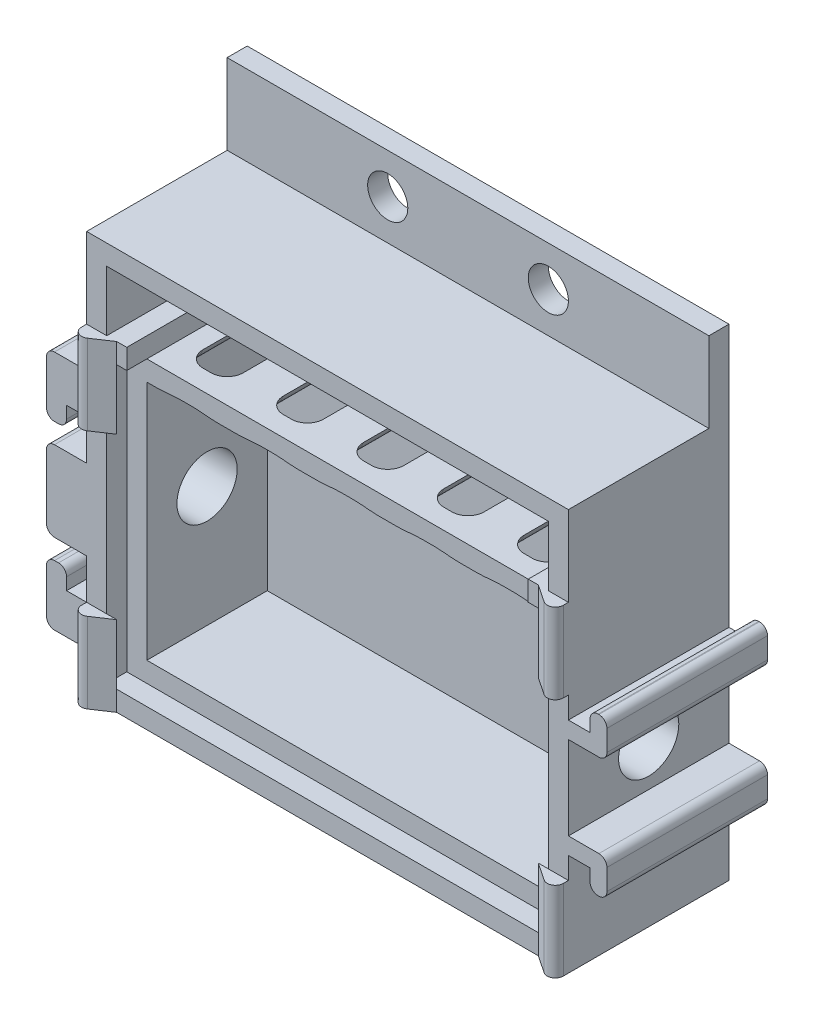
from build123d import *

# Parameters (mm, degrees)
SKETCH1_W               = 76.2
SKETCH1_H               = 76.2
BOSS_EXTRUDE1_DEPTH     = 25.4
SKETCH2_W               = 69.85
SKETCH2_H               = 44.45
CUT_EXTRUDE1_DEPTH      = 3.175
SKETCH9_W               = 63.5
SKETCH9_H               = 38.1
CUT_EXTRUDE9_DEPTH      = 19.05
SKETCH10_W              = 76.2
SKETCH10_H              = 12.7
CUT_EXTRUDE10_DEPTH     = 22.225
CUT_EXTRUDE11_DEPTH     = 22.225
CUT_EXTRUDE12_REACH     = 112.031
SKETCH12_R              = 3.175
CUT_EXTRUDE13_REACH     = 93.801
FILLET3_R               = 5.08
SKETCH14_W              = 25.4
SKETCH14_H              = 38.1
BOSS_EXTRUDE2_DEPTH     = 6.35
CUT_EXTRUDE14_REACH     = 117.179
SKETCH15_R              = 4.7625
CUT_EXTRUDE15_REACH     = 117.179
SKETCH16_W              = 6.35
SKETCH16_H              = 6.35
CUT_EXTRUDE16_REACH     = 117.179
FILLET5_R               = 1.27
SKETCH18_W              = 3.175
SKETCH18_H              = 12.7
BOSS_EXTRUDE3_DEPTH     = 4.7625
CUT_EXTRUDE17_REACH     = 117.739
MIRROR4_COPY_1_SKETCH_W = 3.175
MIRROR4_COPY_1_SKETCH_H = 12.7
MIRROR4_COPY_1_DEPTH    = 4.7625
MIRROR4_COPY_2_REACH    = 117.739
FILLET6_R               = 1.27


with BuildPart() as part:
    # Sketch1 → Boss-Extrude1 (new body)
    with BuildSketch(Plane.XY):
        with Locations((38.1, 38.1)):
            Rectangle(SKETCH1_W, SKETCH1_H)
    extrude(amount=BOSS_EXTRUDE1_DEPTH)

    # Sketch2 → Cut-Extrude1 (cut)
    with BuildSketch(Plane.XY.offset(25.4)):
        with Locations((38.1, 25.4)):
            Rectangle(SKETCH2_W, SKETCH2_H)
    extrude(amount=-CUT_EXTRUDE1_DEPTH, mode=Mode.SUBTRACT)

    # Sketch9 → Cut-Extrude9 (cut)
    with BuildSketch(Plane.XY.offset(22.225)):
        with Locations((38.1, 25.4)):
            Rectangle(SKETCH9_W, SKETCH9_H)
    extrude(amount=-CUT_EXTRUDE9_DEPTH, mode=Mode.SUBTRACT)

    # Sketch10 → Cut-Extrude10 (cut)
    with BuildSketch(Plane.XY.offset(25.4)):
        with Locations((38.1, 69.85)):
            Rectangle(SKETCH10_W, SKETCH10_H)
    extrude(amount=-CUT_EXTRUDE10_DEPTH, mode=Mode.SUBTRACT)

    # Sketch11 → Cut-Extrude11 (cut)
    with BuildSketch(Plane.XY.offset(25.4)):
        Polygon((3.175, 60.325), (73.025, 60.325), (73.025, 50.8), (69.85, 50.8), (69.85, 47.625), (6.35, 47.625), (6.35, 50.8), (3.175, 50.8), align=None)
    extrude(amount=-CUT_EXTRUDE11_DEPTH, mode=Mode.SUBTRACT)

    # Sketch12 → Cut-Extrude12 (cut, up to next)
    with BuildSketch(Plane.XY.offset(3.175), mode=Mode.PRIVATE) as cut_extrude12_sk1:
        with Locations((25.4, 69.85)):
            Circle(SKETCH12_R)
    cut_extrude12_tool1 = extrude(cut_extrude12_sk1.sketch, amount=-CUT_EXTRUDE12_REACH, mode=Mode.PRIVATE) & part.part
    # Sketch12 → Cut-Extrude12 (cut, up to next)
    with BuildSketch(Plane.XY.offset(3.175), mode=Mode.PRIVATE) as cut_extrude12_sk2:
        with Locations((50.8, 69.85)):
            Circle(SKETCH12_R)
    cut_extrude12_tool2 = extrude(cut_extrude12_sk2.sketch, amount=-CUT_EXTRUDE12_REACH, mode=Mode.PRIVATE) & part.part
    add(cut_extrude12_tool1.solids().sort_by_distance((25.4, 69.85, 3.175))[0], mode=Mode.SUBTRACT)
    add(cut_extrude12_tool2.solids().sort_by_distance((50.8, 69.85, 3.175))[0], mode=Mode.SUBTRACT)

    # Sketch13 → Cut-Extrude13 (cut, up to next)
    with BuildSketch(Plane.XZ.offset(-44.45), mode=Mode.PRIVATE) as cut_extrude13_sk1:
        with BuildLine():
            Line((12.065, 19.05), (13.335, 19.05))
            ThreePointArc((13.335, 19.05), (15.131051224, 18.306051224), (15.875, 16.51))
            Line((15.875, 16.51), (15.875, 8.89))
            ThreePointArc((15.875, 8.89), (15.131051224, 7.093948776), (13.335, 6.35))
            Line((13.335, 6.35), (12.065, 6.35))
            ThreePointArc((12.065, 6.35), (10.268948776, 7.093948776), (9.525, 8.89))
            Line((9.525, 8.89), (9.525, 16.51))
            ThreePointArc((9.525, 16.51), (10.268948776, 18.306051224), (12.065, 19.05))
        make_face()
    cut_extrude13_tool1 = extrude(cut_extrude13_sk1.sketch, amount=-CUT_EXTRUDE13_REACH, mode=Mode.PRIVATE) & part.part
    # Sketch13 → Cut-Extrude13 (cut, up to next)
    with BuildSketch(Plane.XZ.offset(-44.45), mode=Mode.PRIVATE) as cut_extrude13_sk2:
        with BuildLine():
            Line((28.575, 16.51), (28.575, 8.89))
            ThreePointArc((28.575, 8.89), (27.831051224, 7.093948776), (26.035, 6.35))
            Line((26.035, 6.35), (24.765, 6.35))
            ThreePointArc((24.765, 6.35), (22.968948776, 7.093948776), (22.225, 8.89))
            Line((22.225, 8.89), (22.225, 16.51))
            ThreePointArc((22.225, 16.51), (22.968948776, 18.306051224), (24.765, 19.05))
            Line((24.765, 19.05), (26.035, 19.05))
            ThreePointArc((26.035, 19.05), (27.831051224, 18.306051224), (28.575, 16.51))
        make_face()
    cut_extrude13_tool2 = extrude(cut_extrude13_sk2.sketch, amount=-CUT_EXTRUDE13_REACH, mode=Mode.PRIVATE) & part.part
    # Sketch13 → Cut-Extrude13 (cut, up to next)
    with BuildSketch(Plane.XZ.offset(-44.45), mode=Mode.PRIVATE) as cut_extrude13_sk3:
        with BuildLine():
            Line((41.275, 16.51), (41.275, 8.89))
            ThreePointArc((41.275, 8.89), (40.531051224, 7.093948776), (38.735, 6.35))
            Line((38.735, 6.35), (37.465, 6.35))
            ThreePointArc((37.465, 6.35), (35.668948776, 7.093948776), (34.925, 8.89))
            Line((34.925, 8.89), (34.925, 16.51))
            ThreePointArc((34.925, 16.51), (35.668948776, 18.306051224), (37.465, 19.05))
            Line((37.465, 19.05), (38.735, 19.05))
            ThreePointArc((38.735, 19.05), (40.531051224, 18.306051224), (41.275, 16.51))
        make_face()
    cut_extrude13_tool3 = extrude(cut_extrude13_sk3.sketch, amount=-CUT_EXTRUDE13_REACH, mode=Mode.PRIVATE) & part.part
    # Sketch13 → Cut-Extrude13 (cut, up to next)
    with BuildSketch(Plane.XZ.offset(-44.45), mode=Mode.PRIVATE) as cut_extrude13_sk4:
        with BuildLine():
            Line((53.975, 16.51), (53.975, 8.89))
            ThreePointArc((53.975, 8.89), (53.231051224, 7.093948776), (51.435, 6.35))
            Line((51.435, 6.35), (50.165, 6.35))
            ThreePointArc((50.165, 6.35), (48.368948776, 7.093948776), (47.625, 8.89))
            Line((47.625, 8.89), (47.625, 16.51))
            ThreePointArc((47.625, 16.51), (48.368948776, 18.306051224), (50.165, 19.05))
            Line((50.165, 19.05), (51.435, 19.05))
            ThreePointArc((51.435, 19.05), (53.231051224, 18.306051224), (53.975, 16.51))
        make_face()
    cut_extrude13_tool4 = extrude(cut_extrude13_sk4.sketch, amount=-CUT_EXTRUDE13_REACH, mode=Mode.PRIVATE) & part.part
    # Sketch13 → Cut-Extrude13 (cut, up to next)
    with BuildSketch(Plane.XZ.offset(-44.45), mode=Mode.PRIVATE) as cut_extrude13_sk5:
        with BuildLine():
            Line((66.675, 16.51), (66.675, 8.89))
            ThreePointArc((66.675, 8.89), (65.931051224, 7.093948776), (64.135, 6.35))
            Line((64.135, 6.35), (62.865, 6.35))
            ThreePointArc((62.865, 6.35), (61.068948776, 7.093948776), (60.325, 8.89))
            Line((60.325, 8.89), (60.325, 16.51))
            ThreePointArc((60.325, 16.51), (61.068948776, 18.306051224), (62.865, 19.05))
            Line((62.865, 19.05), (64.135, 19.05))
            ThreePointArc((64.135, 19.05), (65.931051224, 18.306051224), (66.675, 16.51))
        make_face()
    cut_extrude13_tool5 = extrude(cut_extrude13_sk5.sketch, amount=-CUT_EXTRUDE13_REACH, mode=Mode.PRIVATE) & part.part
    add(cut_extrude13_tool1.solids().sort_by_distance((12.7, 44.45, 12.7))[0], mode=Mode.SUBTRACT)
    add(cut_extrude13_tool2.solids().sort_by_distance((25.4, 44.45, 12.7))[0], mode=Mode.SUBTRACT)
    add(cut_extrude13_tool3.solids().sort_by_distance((38.1, 44.45, 12.7))[0], mode=Mode.SUBTRACT)
    add(cut_extrude13_tool4.solids().sort_by_distance((50.8, 44.45, 12.7))[0], mode=Mode.SUBTRACT)
    add(cut_extrude13_tool5.solids().sort_by_distance((63.5, 44.45, 12.7))[0], mode=Mode.SUBTRACT)

    # Fillet3
    # the kernel refuses this fillet: 5.08 mm, written as the material it takes off along each edge
    with BuildSketch(Plane(origin=(64.135, 44.45, 8.89), x_dir=(1, 0, 0), z_dir=(0, 0, 1))) as fillet3_piece_1_section:
        with BuildLine():
            CenterArc((7.249286039, 5.08), FILLET3_R, 202.024312837, 67.975687163)
            Line((2.54, 3.175), (2.54, 0))
            Line((2.54, 0), (7.249286039, 0))
        make_face()
    fillet3_piece_1 = revolve(axis=Axis((64.135, 44.45, 8.89), (0, 1, 0)), revolution_arc=90, mode=Mode.PRIVATE)
    fillet3_piece_1 = split(fillet3_piece_1, bisect_by=Plane(origin=(69.85, 44.45, 8.89), z_dir=(-1, 0, 0)), keep=Keep.TOP, mode=Mode.PRIVATE)
    fillet3_piece_1 = split(fillet3_piece_1, bisect_by=Plane(origin=(64.135, 44.45, 3.175), z_dir=(0, 0, 1)), keep=Keep.TOP, mode=Mode.PRIVATE)
    add(fillet3_piece_1, mode=Mode.SUBTRACT)
    with BuildSketch(Plane(origin=(62.865, 44.45, 8.89), x_dir=(0, 0, -1), z_dir=(1, 0, 0))) as fillet3_piece_2_section:
        with BuildLine():
            CenterArc((7.249286039, 5.08), FILLET3_R, 202.024312837, 67.975687163)
            Line((2.54, 3.175), (2.54, 0))
            Line((2.54, 0), (7.249286039, 0))
        make_face()
    fillet3_piece_2 = revolve(axis=Axis((62.865, 44.45, 8.89), (0, 1, 0)), revolution_arc=90, mode=Mode.PRIVATE)
    fillet3_piece_2 = split(fillet3_piece_2, bisect_by=Plane(origin=(62.865, 44.45, 3.175), z_dir=(0, 0, 1)), keep=Keep.TOP, mode=Mode.PRIVATE)
    add(fillet3_piece_2, mode=Mode.SUBTRACT)
    with BuildSketch(Plane(origin=(60.325, 44.45, 8.89), x_dir=(-1, 0, 0), z_dir=(0, 0, 1)), Plane(origin=(47.625, 44.45, 8.89), x_dir=(-1, 0, 0), z_dir=(0, 0, 1)), Plane(origin=(34.925, 44.45, 8.89), x_dir=(-1, 0, 0), z_dir=(0, 0, 1)), Plane(origin=(22.225, 44.45, 8.89), x_dir=(-1, 0, 0), z_dir=(0, 0, 1)), Plane(origin=(53.975, 44.45, 16.51), x_dir=(1, 0, 0), z_dir=(0, 0, -1)), Plane(origin=(41.275, 44.45, 16.51), x_dir=(1, 0, 0), z_dir=(0, 0, -1)), Plane(origin=(28.575, 44.45, 16.51), x_dir=(1, 0, 0), z_dir=(0, 0, -1)), Plane(origin=(15.875, 44.45, 16.51), x_dir=(1, 0, 0), z_dir=(0, 0, -1))) as fillet3_piece_3:
        with BuildLine():
            CenterArc((4.709286039, -5.08), FILLET3_R, 90, 67.975687163)
            Line((0, -3.175), (0, 0))
            Line((0, 0), (4.709286039, 0))
        make_face()
    extrude(amount=7.62, mode=Mode.SUBTRACT)
    with BuildSketch(Plane(origin=(62.865, 44.45, 16.51), x_dir=(-1, 0, 0), z_dir=(0, 0, -1))) as fillet3_piece_4:
        with BuildLine():
            CenterArc((7.249286039, 5.08), FILLET3_R, 202.024312837, 67.975687163)
            Line((2.54, 3.175), (2.54, 0))
            Line((2.54, 0), (7.249286039, 0))
        make_face()
    revolve(axis=Axis((62.865, 44.45, 16.51), (0, 1, 0)), revolution_arc=90, mode=Mode.SUBTRACT)
    with BuildSketch(Plane(origin=(64.135, 44.45, 16.51), x_dir=(0, 0, 1), z_dir=(-1, 0, 0))) as fillet3_piece_5_section:
        with BuildLine():
            CenterArc((7.249286039, 5.08), FILLET3_R, 202.024312837, 67.975687163)
            Line((2.54, 3.175), (2.54, 0))
            Line((2.54, 0), (7.249286039, 0))
        make_face()
    fillet3_piece_5 = revolve(axis=Axis((64.135, 44.45, 16.51), (0, 1, 0)), revolution_arc=90, mode=Mode.PRIVATE)
    fillet3_piece_5 = split(fillet3_piece_5, bisect_by=Plane(origin=(69.85, 44.45, 16.51), z_dir=(-1, 0, 0)), keep=Keep.TOP, mode=Mode.PRIVATE)
    add(fillet3_piece_5, mode=Mode.SUBTRACT)
    with BuildSketch(Plane(origin=(51.435, 44.45, 8.89), x_dir=(1, 0, 0), z_dir=(0, 0, 1))) as fillet3_piece_6_section:
        with BuildLine():
            CenterArc((7.249286039, 5.08), FILLET3_R, 202.024312837, 67.975687163)
            Line((2.54, 3.175), (2.54, 0))
            Line((2.54, 0), (7.249286039, 0))
        make_face()
    fillet3_piece_6 = revolve(axis=Axis((51.435, 44.45, 8.89), (0, 1, 0)), revolution_arc=90, mode=Mode.PRIVATE)
    fillet3_piece_6 = split(fillet3_piece_6, bisect_by=Plane(origin=(51.435, 44.45, 3.175), z_dir=(0, 0, 1)), keep=Keep.TOP, mode=Mode.PRIVATE)
    add(fillet3_piece_6, mode=Mode.SUBTRACT)
    with BuildSketch(Plane(origin=(50.165, 44.45, 8.89), x_dir=(0, 0, -1), z_dir=(1, 0, 0))) as fillet3_piece_7_section:
        with BuildLine():
            CenterArc((7.249286039, 5.08), FILLET3_R, 202.024312837, 67.975687163)
            Line((2.54, 3.175), (2.54, 0))
            Line((2.54, 0), (7.249286039, 0))
        make_face()
    fillet3_piece_7 = revolve(axis=Axis((50.165, 44.45, 8.89), (0, 1, 0)), revolution_arc=90, mode=Mode.PRIVATE)
    fillet3_piece_7 = split(fillet3_piece_7, bisect_by=Plane(origin=(50.165, 44.45, 3.175), z_dir=(0, 0, 1)), keep=Keep.TOP, mode=Mode.PRIVATE)
    add(fillet3_piece_7, mode=Mode.SUBTRACT)
    with BuildSketch(Plane(origin=(50.165, 44.45, 16.51), x_dir=(-1, 0, 0), z_dir=(0, 0, -1))) as fillet3_piece_8:
        with BuildLine():
            CenterArc((7.249286039, 5.08), FILLET3_R, 202.024312837, 67.975687163)
            Line((2.54, 3.175), (2.54, 0))
            Line((2.54, 0), (7.249286039, 0))
        make_face()
    revolve(axis=Axis((50.165, 44.45, 16.51), (0, 1, 0)), revolution_arc=90, mode=Mode.SUBTRACT)
    with BuildSketch(Plane(origin=(51.435, 44.45, 16.51), x_dir=(0, 0, 1), z_dir=(-1, 0, 0))) as fillet3_piece_9:
        with BuildLine():
            CenterArc((7.249286039, 5.08), FILLET3_R, 202.024312837, 67.975687163)
            Line((2.54, 3.175), (2.54, 0))
            Line((2.54, 0), (7.249286039, 0))
        make_face()
    revolve(axis=Axis((51.435, 44.45, 16.51), (0, 1, 0)), revolution_arc=90, mode=Mode.SUBTRACT)
    with BuildSketch(Plane(origin=(38.735, 44.45, 8.89), x_dir=(1, 0, 0), z_dir=(0, 0, 1))) as fillet3_piece_10_section:
        with BuildLine():
            CenterArc((7.249286039, 5.08), FILLET3_R, 202.024312837, 67.975687163)
            Line((2.54, 3.175), (2.54, 0))
            Line((2.54, 0), (7.249286039, 0))
        make_face()
    fillet3_piece_10 = revolve(axis=Axis((38.735, 44.45, 8.89), (0, 1, 0)), revolution_arc=90, mode=Mode.PRIVATE)
    fillet3_piece_10 = split(fillet3_piece_10, bisect_by=Plane(origin=(38.735, 44.45, 3.175), z_dir=(0, 0, 1)), keep=Keep.TOP, mode=Mode.PRIVATE)
    add(fillet3_piece_10, mode=Mode.SUBTRACT)
    with BuildSketch(Plane(origin=(37.465, 44.45, 8.89), x_dir=(0, 0, -1), z_dir=(1, 0, 0))) as fillet3_piece_11_section:
        with BuildLine():
            CenterArc((7.249286039, 5.08), FILLET3_R, 202.024312837, 67.975687163)
            Line((2.54, 3.175), (2.54, 0))
            Line((2.54, 0), (7.249286039, 0))
        make_face()
    fillet3_piece_11 = revolve(axis=Axis((37.465, 44.45, 8.89), (0, 1, 0)), revolution_arc=90, mode=Mode.PRIVATE)
    fillet3_piece_11 = split(fillet3_piece_11, bisect_by=Plane(origin=(37.465, 44.45, 3.175), z_dir=(0, 0, 1)), keep=Keep.TOP, mode=Mode.PRIVATE)
    add(fillet3_piece_11, mode=Mode.SUBTRACT)
    with BuildSketch(Plane(origin=(37.465, 44.45, 16.51), x_dir=(-1, 0, 0), z_dir=(0, 0, -1))) as fillet3_piece_12:
        with BuildLine():
            CenterArc((7.249286039, 5.08), FILLET3_R, 202.024312837, 67.975687163)
            Line((2.54, 3.175), (2.54, 0))
            Line((2.54, 0), (7.249286039, 0))
        make_face()
    revolve(axis=Axis((37.465, 44.45, 16.51), (0, 1, 0)), revolution_arc=90, mode=Mode.SUBTRACT)
    with BuildSketch(Plane(origin=(38.735, 44.45, 16.51), x_dir=(0, 0, 1), z_dir=(-1, 0, 0))) as fillet3_piece_13:
        with BuildLine():
            CenterArc((7.249286039, 5.08), FILLET3_R, 202.024312837, 67.975687163)
            Line((2.54, 3.175), (2.54, 0))
            Line((2.54, 0), (7.249286039, 0))
        make_face()
    revolve(axis=Axis((38.735, 44.45, 16.51), (0, 1, 0)), revolution_arc=90, mode=Mode.SUBTRACT)
    with BuildSketch(Plane(origin=(26.035, 44.45, 8.89), x_dir=(1, 0, 0), z_dir=(0, 0, 1))) as fillet3_piece_14_section:
        with BuildLine():
            CenterArc((7.249286039, 5.08), FILLET3_R, 202.024312837, 67.975687163)
            Line((2.54, 3.175), (2.54, 0))
            Line((2.54, 0), (7.249286039, 0))
        make_face()
    fillet3_piece_14 = revolve(axis=Axis((26.035, 44.45, 8.89), (0, 1, 0)), revolution_arc=90, mode=Mode.PRIVATE)
    fillet3_piece_14 = split(fillet3_piece_14, bisect_by=Plane(origin=(26.035, 44.45, 3.175), z_dir=(0, 0, 1)), keep=Keep.TOP, mode=Mode.PRIVATE)
    add(fillet3_piece_14, mode=Mode.SUBTRACT)
    with BuildSketch(Plane(origin=(24.765, 44.45, 8.89), x_dir=(0, 0, -1), z_dir=(1, 0, 0))) as fillet3_piece_15_section:
        with BuildLine():
            CenterArc((7.249286039, 5.08), FILLET3_R, 202.024312837, 67.975687163)
            Line((2.54, 3.175), (2.54, 0))
            Line((2.54, 0), (7.249286039, 0))
        make_face()
    fillet3_piece_15 = revolve(axis=Axis((24.765, 44.45, 8.89), (0, 1, 0)), revolution_arc=90, mode=Mode.PRIVATE)
    fillet3_piece_15 = split(fillet3_piece_15, bisect_by=Plane(origin=(24.765, 44.45, 3.175), z_dir=(0, 0, 1)), keep=Keep.TOP, mode=Mode.PRIVATE)
    add(fillet3_piece_15, mode=Mode.SUBTRACT)
    with BuildSketch(Plane(origin=(24.765, 44.45, 16.51), x_dir=(-1, 0, 0), z_dir=(0, 0, -1))) as fillet3_piece_16:
        with BuildLine():
            CenterArc((7.249286039, 5.08), FILLET3_R, 202.024312837, 67.975687163)
            Line((2.54, 3.175), (2.54, 0))
            Line((2.54, 0), (7.249286039, 0))
        make_face()
    revolve(axis=Axis((24.765, 44.45, 16.51), (0, 1, 0)), revolution_arc=90, mode=Mode.SUBTRACT)
    with BuildSketch(Plane(origin=(26.035, 44.45, 16.51), x_dir=(0, 0, 1), z_dir=(-1, 0, 0))) as fillet3_piece_17:
        with BuildLine():
            CenterArc((7.249286039, 5.08), FILLET3_R, 202.024312837, 67.975687163)
            Line((2.54, 3.175), (2.54, 0))
            Line((2.54, 0), (7.249286039, 0))
        make_face()
    revolve(axis=Axis((26.035, 44.45, 16.51), (0, 1, 0)), revolution_arc=90, mode=Mode.SUBTRACT)
    with BuildSketch(Plane(origin=(13.335, 44.45, 8.89), x_dir=(1, 0, 0), z_dir=(0, 0, 1))) as fillet3_piece_18_section:
        with BuildLine():
            CenterArc((7.249286039, 5.08), FILLET3_R, 202.024312837, 67.975687163)
            Line((2.54, 3.175), (2.54, 0))
            Line((2.54, 0), (7.249286039, 0))
        make_face()
    fillet3_piece_18 = revolve(axis=Axis((13.335, 44.45, 8.89), (0, 1, 0)), revolution_arc=90, mode=Mode.PRIVATE)
    fillet3_piece_18 = split(fillet3_piece_18, bisect_by=Plane(origin=(13.335, 44.45, 3.175), z_dir=(0, 0, 1)), keep=Keep.TOP, mode=Mode.PRIVATE)
    add(fillet3_piece_18, mode=Mode.SUBTRACT)
    with BuildSketch(Plane(origin=(12.065, 44.45, 8.89), x_dir=(0, 0, -1), z_dir=(1, 0, 0))) as fillet3_piece_19_section:
        with BuildLine():
            CenterArc((7.249286039, 5.08), FILLET3_R, 202.024312837, 67.975687163)
            Line((2.54, 3.175), (2.54, 0))
            Line((2.54, 0), (7.249286039, 0))
        make_face()
    fillet3_piece_19 = revolve(axis=Axis((12.065, 44.45, 8.89), (0, 1, 0)), revolution_arc=90, mode=Mode.PRIVATE)
    fillet3_piece_19 = split(fillet3_piece_19, bisect_by=Plane(origin=(6.35, 44.45, 8.89), z_dir=(1, 0, 0)), keep=Keep.TOP, mode=Mode.PRIVATE)
    fillet3_piece_19 = split(fillet3_piece_19, bisect_by=Plane(origin=(12.065, 44.45, 3.175), z_dir=(0, 0, 1)), keep=Keep.TOP, mode=Mode.PRIVATE)
    add(fillet3_piece_19, mode=Mode.SUBTRACT)
    with BuildSketch(Plane(origin=(12.065, 44.45, 16.51), x_dir=(-1, 0, 0), z_dir=(0, 0, -1))) as fillet3_piece_20_section:
        with BuildLine():
            CenterArc((7.249286039, 5.08), FILLET3_R, 202.024312837, 67.975687163)
            Line((2.54, 3.175), (2.54, 0))
            Line((2.54, 0), (7.249286039, 0))
        make_face()
    fillet3_piece_20 = revolve(axis=Axis((12.065, 44.45, 16.51), (0, 1, 0)), revolution_arc=90, mode=Mode.PRIVATE)
    fillet3_piece_20 = split(fillet3_piece_20, bisect_by=Plane(origin=(6.35, 44.45, 16.51), z_dir=(1, 0, 0)), keep=Keep.TOP, mode=Mode.PRIVATE)
    add(fillet3_piece_20, mode=Mode.SUBTRACT)
    with BuildSketch(Plane(origin=(13.335, 44.45, 16.51), x_dir=(0, 0, 1), z_dir=(-1, 0, 0))) as fillet3_piece_21:
        with BuildLine():
            CenterArc((7.249286039, 5.08), FILLET3_R, 202.024312837, 67.975687163)
            Line((2.54, 3.175), (2.54, 0))
            Line((2.54, 0), (7.249286039, 0))
        make_face()
    revolve(axis=Axis((13.335, 44.45, 16.51), (0, 1, 0)), revolution_arc=90, mode=Mode.SUBTRACT)
    with BuildSketch(Plane(origin=(12.065, 44.45, 19.05), x_dir=(0, 0, 1), z_dir=(1, 0, 0)), Plane(origin=(24.765, 44.45, 19.05), x_dir=(0, 0, 1), z_dir=(1, 0, 0)), Plane(origin=(37.465, 44.45, 19.05), x_dir=(0, 0, 1), z_dir=(1, 0, 0)), Plane(origin=(50.165, 44.45, 19.05), x_dir=(0, 0, 1), z_dir=(1, 0, 0)), Plane(origin=(62.865, 44.45, 19.05), x_dir=(0, 0, 1), z_dir=(1, 0, 0))) as fillet3_piece_22:
        with BuildLine():
            CenterArc((4.709286039, -5.08), FILLET3_R, 90, 67.975687163)
            Line((0, -3.175), (0, 0))
            Line((0, 0), (4.709286039, 0))
        make_face()
    extrude(amount=1.27, mode=Mode.SUBTRACT)
    with BuildSketch(Plane(origin=(9.525, 44.45, 8.89), x_dir=(-1, 0, 0), z_dir=(0, 0, 1))) as fillet3_piece_23_section:
        with BuildLine():
            CenterArc((4.709286039, -5.08), FILLET3_R, 90, 67.975687163)
            Line((0, -3.175), (0, 0))
            Line((0, 0), (4.709286039, 0))
        make_face()
    fillet3_piece_23 = extrude(amount=7.62, mode=Mode.PRIVATE)
    fillet3_piece_23 = split(fillet3_piece_23, bisect_by=Plane(origin=(6.35, 44.45, 8.89), z_dir=(1, 0, 0)), keep=Keep.TOP, mode=Mode.PRIVATE)
    add(fillet3_piece_23, mode=Mode.SUBTRACT)
    with BuildSketch(Plane(origin=(13.335, 44.45, 6.35), x_dir=(0, 0, -1), z_dir=(-1, 0, 0))) as fillet3_piece_24_section:
        with BuildLine():
            CenterArc((4.709286039, -5.08), FILLET3_R, 90, 67.975687163)
            Line((0, -3.175), (0, 0))
            Line((0, 0), (4.709286039, 0))
        make_face()
    fillet3_piece_24 = extrude(amount=1.27, mode=Mode.PRIVATE)
    fillet3_piece_24 = split(fillet3_piece_24, bisect_by=Plane(origin=(13.335, 44.45, 3.175), z_dir=(0, 0, 1)), keep=Keep.TOP, mode=Mode.PRIVATE)
    add(fillet3_piece_24, mode=Mode.SUBTRACT)
    with BuildSketch(Plane(origin=(26.035, 44.45, 6.35), x_dir=(0, 0, -1), z_dir=(-1, 0, 0))) as fillet3_piece_25_section:
        with BuildLine():
            CenterArc((4.709286039, -5.08), FILLET3_R, 90, 67.975687163)
            Line((0, -3.175), (0, 0))
            Line((0, 0), (4.709286039, 0))
        make_face()
    fillet3_piece_25 = extrude(amount=1.27, mode=Mode.PRIVATE)
    fillet3_piece_25 = split(fillet3_piece_25, bisect_by=Plane(origin=(26.035, 44.45, 3.175), z_dir=(0, 0, 1)), keep=Keep.TOP, mode=Mode.PRIVATE)
    add(fillet3_piece_25, mode=Mode.SUBTRACT)
    with BuildSketch(Plane(origin=(38.735, 44.45, 6.35), x_dir=(0, 0, -1), z_dir=(-1, 0, 0))) as fillet3_piece_26_section:
        with BuildLine():
            CenterArc((4.709286039, -5.08), FILLET3_R, 90, 67.975687163)
            Line((0, -3.175), (0, 0))
            Line((0, 0), (4.709286039, 0))
        make_face()
    fillet3_piece_26 = extrude(amount=1.27, mode=Mode.PRIVATE)
    fillet3_piece_26 = split(fillet3_piece_26, bisect_by=Plane(origin=(38.735, 44.45, 3.175), z_dir=(0, 0, 1)), keep=Keep.TOP, mode=Mode.PRIVATE)
    add(fillet3_piece_26, mode=Mode.SUBTRACT)
    with BuildSketch(Plane(origin=(51.435, 44.45, 6.35), x_dir=(0, 0, -1), z_dir=(-1, 0, 0))) as fillet3_piece_27_section:
        with BuildLine():
            CenterArc((4.709286039, -5.08), FILLET3_R, 90, 67.975687163)
            Line((0, -3.175), (0, 0))
            Line((0, 0), (4.709286039, 0))
        make_face()
    fillet3_piece_27 = extrude(amount=1.27, mode=Mode.PRIVATE)
    fillet3_piece_27 = split(fillet3_piece_27, bisect_by=Plane(origin=(51.435, 44.45, 3.175), z_dir=(0, 0, 1)), keep=Keep.TOP, mode=Mode.PRIVATE)
    add(fillet3_piece_27, mode=Mode.SUBTRACT)
    with BuildSketch(Plane(origin=(66.675, 44.45, 16.51), x_dir=(1, 0, 0), z_dir=(0, 0, -1))) as fillet3_piece_28_section:
        with BuildLine():
            CenterArc((4.709286039, -5.08), FILLET3_R, 90, 67.975687163)
            Line((0, -3.175), (0, 0))
            Line((0, 0), (4.709286039, 0))
        make_face()
    fillet3_piece_28 = extrude(amount=7.62, mode=Mode.PRIVATE)
    fillet3_piece_28 = split(fillet3_piece_28, bisect_by=Plane(origin=(69.85, 44.45, 16.51), z_dir=(-1, 0, 0)), keep=Keep.TOP, mode=Mode.PRIVATE)
    add(fillet3_piece_28, mode=Mode.SUBTRACT)
    with BuildSketch(Plane(origin=(64.135, 44.45, 6.35), x_dir=(0, 0, -1), z_dir=(-1, 0, 0))) as fillet3_piece_29_section:
        with BuildLine():
            CenterArc((4.709286039, -5.08), FILLET3_R, 90, 67.975687163)
            Line((0, -3.175), (0, 0))
            Line((0, 0), (4.709286039, 0))
        make_face()
    fillet3_piece_29 = extrude(amount=1.27, mode=Mode.PRIVATE)
    fillet3_piece_29 = split(fillet3_piece_29, bisect_by=Plane(origin=(64.135, 44.45, 3.175), z_dir=(0, 0, 1)), keep=Keep.TOP, mode=Mode.PRIVATE)
    add(fillet3_piece_29, mode=Mode.SUBTRACT)

    # Sketch14 → Boss-Extrude2 (add)
    with BuildSketch(Plane.ZY):
        with Locations((12.7, 25.4)):
            Rectangle(SKETCH14_W, SKETCH14_H)
    boss_extrude2 = extrude(amount=BOSS_EXTRUDE2_DEPTH)

    # Sketch15 → Cut-Extrude14 (cut, up to next)
    with BuildSketch(Plane.ZY.offset(6.35), mode=Mode.PRIVATE) as cut_extrude14_sk1:
        with Locations((12.7, 25.4)):
            Circle(SKETCH15_R)
    cut_extrude14_tool1 = extrude(cut_extrude14_sk1.sketch, amount=-CUT_EXTRUDE14_REACH, mode=Mode.PRIVATE) & part.part
    cut_extrude14 = cut_extrude14_tool1.solids().sort_by_distance((-6.35, 25.4, 12.7))[0]
    add(cut_extrude14, mode=Mode.SUBTRACT)

    # Mirror1: Boss-Extrude2, Cut-Extrude14 across plane
    add(boss_extrude2.mirror(Plane(origin=(38.1, 0, 0), x_dir=(0, 0, 1), z_dir=(1, 0, 0))))
    add(cut_extrude14.mirror(Plane(origin=(38.1, 0, 0), x_dir=(0, 0, 1), z_dir=(1, 0, 0))), mode=Mode.SUBTRACT)

    # Sketch16 → Cut-Extrude15 (cut, up to next)
    with BuildSketch(Plane.XY.offset(25.4), mode=Mode.PRIVATE) as cut_extrude15_sk1:
        Polygon((-6.35, 19.05), (0, 19.05), (0, 12.7), (-3.175, 12.7), (-3.175, 15.875), (-6.35, 15.875), align=None)
    cut_extrude15_tool1 = extrude(cut_extrude15_sk1.sketch, amount=-CUT_EXTRUDE15_REACH, mode=Mode.PRIVATE) & part.part
    # Sketch16 → Cut-Extrude15 (cut, up to next)
    with BuildSketch(Plane.XY.offset(25.4), mode=Mode.PRIVATE) as cut_extrude15_sk2:
        with Locations((79.375, 22.225)):
            Rectangle(SKETCH16_W, SKETCH16_H)
    cut_extrude15_tool2 = extrude(cut_extrude15_sk2.sketch, amount=-CUT_EXTRUDE15_REACH, mode=Mode.PRIVATE) & part.part
    # Sketch16 → Cut-Extrude15 (cut, up to next)
    with BuildSketch(Plane.XY.offset(25.4), mode=Mode.PRIVATE) as cut_extrude15_sk3:
        Polygon((76.2, 6.35), (76.2, 15.875), (79.375, 15.875), (79.375, 12.7), (82.55, 12.7), (82.55, 6.35), align=None)
    cut_extrude15_tool3 = extrude(cut_extrude15_sk3.sketch, amount=-CUT_EXTRUDE15_REACH, mode=Mode.PRIVATE) & part.part
    cut_extrude15_1 = cut_extrude15_tool1.solids().sort_by_distance((-2.645833, 16.404167, 25.4))[0]
    add(cut_extrude15_1, mode=Mode.SUBTRACT)
    cut_extrude15_2 = cut_extrude15_tool2.solids().sort_by_distance((79.375, 22.225, 25.4))[0]
    add(cut_extrude15_2, mode=Mode.SUBTRACT)
    cut_extrude15_3 = cut_extrude15_tool3.solids().sort_by_distance((79.0575, 10.4775, 25.4))[0]
    add(cut_extrude15_3, mode=Mode.SUBTRACT)
    cut_extrude15 = cut_extrude15_1 + cut_extrude15_2 + cut_extrude15_3  # Cut-Extrude15 as one shape, for the pattern or mirror that repeats it

    # Sketch17 → Cut-Extrude16 (cut, up to next)
    with BuildSketch(Plane.XY.offset(25.4), mode=Mode.PRIVATE) as cut_extrude16_sk1:
        Polygon((76.2, 16.129), (76.2, 15.875), (79.375, 15.875), (79.375, 12.7), (82.55, 12.7), (82.55, 19.05), (76.2, 19.05), (76.2, 18.796), (82.296, 18.796), (82.296, 12.954), (79.629, 12.954), (79.629, 16.129), align=None)
    cut_extrude16_tool1 = extrude(cut_extrude16_sk1.sketch, amount=-CUT_EXTRUDE16_REACH, mode=Mode.PRIVATE) & part.part
    cut_extrude16 = cut_extrude16_tool1.solids().sort_by_distance((76.289803, 16.002, 25.4))[0]
    add(cut_extrude16, mode=Mode.SUBTRACT)

    # Mirror2: Cut-Extrude15, Cut-Extrude16 across plane
    add(cut_extrude15.mirror(Plane.ZX.offset(25.4)), mode=Mode.SUBTRACT)
    add(cut_extrude16.mirror(Plane.ZX.offset(25.4)), mode=Mode.SUBTRACT)

    # Fillet5
    fillet5_edges = [part.edges().sort_by_distance(p)[0] for p in [
        (79.629, 37.846, 12.7),
        (82.296, 37.846, 12.7),
        (82.296, 32.004, 12.7),
        (82.296, 18.796, 12.7),
        (79.629, 12.954, 12.7),
        (82.296, 12.954, 12.7),
        (-3.175, 34.925, 12.7),
        (-6.35, 44.45, 12.7),
        (-6.35, 34.925, 12.7),
        (-6.35, 31.75, 12.7),
        (-6.35, 19.05, 12.7),
        (-6.35, 6.35, 12.7),
        (-3.175, 15.875, 12.7),
        (-6.35, 15.875, 12.7),
    ]]
    fillet(fillet5_edges, radius=FILLET5_R)

    # Sketch18 → Boss-Extrude3 (add)
    with BuildSketch(Plane(origin=(0, 0, 0), x_dir=(0, 0, -1), z_dir=(1, 0, 0))):
        with Locations((-26.9875, 6.35)):
            Rectangle(SKETCH18_W, SKETCH18_H)
    boss_extrude3 = extrude(amount=BOSS_EXTRUDE3_DEPTH)

    # Sketch19 → Cut-Extrude17 (cut, up to next)
    with BuildSketch(Plane.XZ, mode=Mode.PRIVATE) as cut_extrude17_sk1:
        Polygon((0, 28.575), (4.7625, 25.4), (4.7625, 28.575), align=None)
    cut_extrude17_tool1 = extrude(cut_extrude17_sk1.sketch, amount=-CUT_EXTRUDE17_REACH, mode=Mode.PRIVATE) & part.part
    cut_extrude17 = cut_extrude17_tool1.solids().sort_by_distance((3.175, 0, 27.516667))[0]
    add(cut_extrude17, mode=Mode.SUBTRACT)

    # Mirror3: Boss-Extrude3, Cut-Extrude17 across plane
    add(boss_extrude3.mirror(Plane(origin=(38.1, 0, 0), x_dir=(0, 0, 1), z_dir=(1, 0, 0))))
    add(cut_extrude17.mirror(Plane(origin=(38.1, 0, 0), x_dir=(0, 0, 1), z_dir=(1, 0, 0))), mode=Mode.SUBTRACT)

    # Mirror4: Boss-Extrude3, Cut-Extrude17 across plane
    add(boss_extrude3.mirror(Plane.ZX.offset(25.4)))
    add(cut_extrude17.mirror(Plane.ZX.offset(25.4)), mode=Mode.SUBTRACT)

    # Mirror4 copy 1 sketch → Mirror4 copy 1 (add)
    with BuildSketch(Plane(origin=(76.2, 50.8, 0), x_dir=(0, 0, -1), z_dir=(-1, 0, 0))):
        with Locations((-26.9875, 6.35)):
            Rectangle(MIRROR4_COPY_1_SKETCH_W, MIRROR4_COPY_1_SKETCH_H)
    extrude(amount=MIRROR4_COPY_1_DEPTH)

    # Mirror4 copy 2 sketch → Mirror4 copy 2 (cut, up to next)
    with BuildSketch(Plane(origin=(76.2, 50.8, 0), x_dir=(-1, 0, 0), z_dir=(0, 1, 0)), mode=Mode.PRIVATE) as mirror4_copy_2_sk1:
        Polygon((0, 28.575), (4.7625, 25.4), (4.7625, 28.575), align=None)
    mirror4_copy_2_tool1 = extrude(mirror4_copy_2_sk1.sketch, amount=-MIRROR4_COPY_2_REACH, mode=Mode.PRIVATE) & part.part
    add(mirror4_copy_2_tool1.solids().sort_by_distance((73.025, 50.8, 27.516667))[0], mode=Mode.SUBTRACT)

    # Fillet6
    fillet6_edges = [part.edges().sort_by_distance(p)[0] for p in [
        (0, 6.35, 28.575),
        (76.2, 6.35, 28.575),
        (76.2, 44.45, 28.575),
        (0, 44.45, 28.575),
    ]]
    fillet(fillet6_edges, radius=FILLET6_R)


solid = part.part
